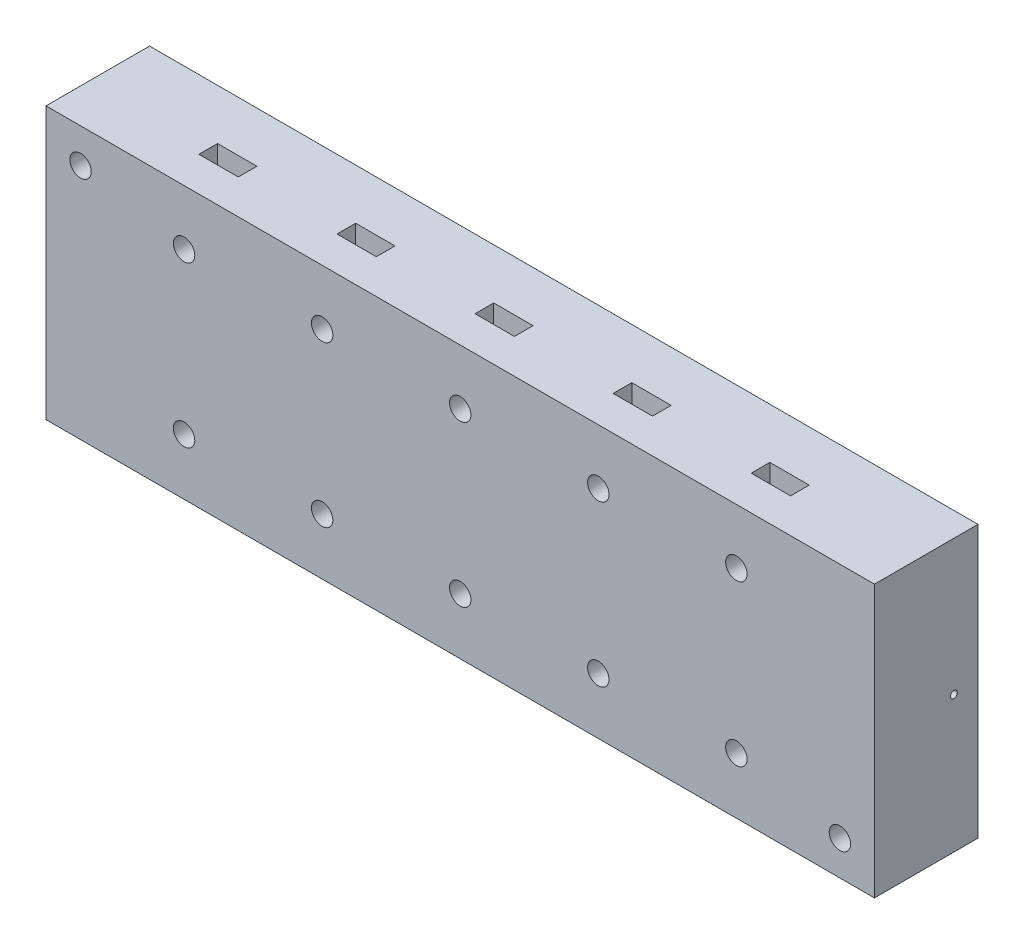
from build123d import *

# Parameters (mm, degrees)
SKIZZE2_W                        = 120
SKIZZE2_H                        = 39.364160046
AUFSATZ_LINEAR_AUSTRAGEN1_DEPTH  = 30
SKIZZE24_R                       = 1.55
SCHNITT_LINEAR_AUSTRAGEN4_DEPTH  = 130.805766806
SKIZZE46_R                       = 2.85
SCHNITT_LINEAR_AUSTRAGEN15_DEPTH = 10
SCHNITT_LINEAR_START             = -5
SCHNITT_LINEAR_AUSTRAGEN25_DEPTH = 2.7
LINEARES_MUSTER1_COUNT           = 5
LINEARES_MUSTER1_PITCH           = 20
SPIEGELN2_COPY_1_SKETCH_R        = 2.85
SPIEGELN2_COPY_1_DEPTH           = 10
SPIEGELN2_COPY_2_SKETCH_R        = 2.85
SPIEGELN2_COPY_2_DEPTH           = 10
SPIEGELN2_COPY_3_SKETCH_R        = 2.85
SPIEGELN2_COPY_3_DEPTH           = 10
SPIEGELN2_COPY_4_SKETCH_R        = 2.85
SPIEGELN2_COPY_4_DEPTH           = 10
SPIEGELN2_START                  = -5
SPIEGELN2_COPY_5_DEPTH           = 2.7
SPIEGELN2_COPY_6_DEPTH           = 2.7
SPIEGELN2_COPY_7_DEPTH           = 2.7
SPIEGELN2_COPY_8_DEPTH           = 2.7
SKIZZE51_R                       = 1.55
SCHNITT_LINEAR_AUSTRAGEN26_DEPTH = 130.805766806
SKIZZE67_R                       = 0.5
SCHNITT_LINEAR_AUSTRAGEN28_DEPTH = 16
SKIZZE68_R                       = 0.65
SCHNITT_LINEAR_AUSTRAGEN30_DEPTH = 16
SKIZZE70_R                       = 2
SCHNITT_LINEAR_AUSTRAGEN31_DEPTH = 6
ABSPALTEN3_OUTLINE_W             = 120
ABSPALTEN3_OUTLINE_H             = 39.364160046
ABSPALTEN3_OUTLINE_R             = 1.55
ABSPALTEN3_DEPTH                 = 15


# Read off the part's stored shape, not the designer's step: Abspalten3
with BuildPart() as part:
    # Skizze2 → Aufsatz-Linear austragen1 (new body)
    with BuildSketch(Plane.XY):
        with Locations((60, 19.682080023)):
            Rectangle(SKIZZE2_W, SKIZZE2_H)
    extrude(amount=AUFSATZ_LINEAR_AUSTRAGEN1_DEPTH)

    # Skizze24 → Schnitt-Linear austragen4 (cut, through all)
    with BuildSketch(Plane.XY.offset(30)):
        with Locations((20, 31.364160046)):
            Circle(SKIZZE24_R)
        with Locations((40, 31.364160046)):
            Circle(SKIZZE24_R)
        with Locations((60, 31.364160046)):
            Circle(SKIZZE24_R)
        with Locations((80, 31.364160046)):
            Circle(SKIZZE24_R)
        with Locations((100, 31.364160046)):
            Circle(SKIZZE24_R)
    schnitt_linear_austragen4 = extrude(amount=-SCHNITT_LINEAR_AUSTRAGEN4_DEPTH, mode=Mode.SUBTRACT)

    # Skizze46 → Schnitt-Linear austragen15 (cut)
    with BuildSketch(Plane(origin=(0, 0, 0), x_dir=(-1, 0, 0), z_dir=(0, 0, -1))):
        with Locations((-100, 31.364160046)):
            Circle(SKIZZE46_R)
    schnitt_linear_austragen15 = extrude(amount=-SCHNITT_LINEAR_AUSTRAGEN15_DEPTH, mode=Mode.SUBTRACT)

    # Skizze50 → Schnitt-Linear austragen25 (cut)
    with BuildSketch(Plane.XY.offset(30).offset(SCHNITT_LINEAR_START)):
        Polygon((97.15, 33.009608314), (97.15, 39.364160046), (102.85, 39.364160046), (102.85, 33.009608314), (102.85, 29.718711779), (100, 28.073263512), (97.15, 29.718711779), align=None)
    schnitt_linear_austragen25 = extrude(amount=-SCHNITT_LINEAR_AUSTRAGEN25_DEPTH, mode=Mode.SUBTRACT)

    # Lineares Muster1: Schnitt-Linear austragen15, Schnitt-Linear austragen25 ×5
    with Locations(*[(-i * LINEARES_MUSTER1_PITCH, 0, 0) for i in range(1, LINEARES_MUSTER1_COUNT)]):
        add(schnitt_linear_austragen15, mode=Mode.SUBTRACT)
        add(schnitt_linear_austragen25, mode=Mode.SUBTRACT)

    # Spiegeln2: Schnitt-Linear austragen15, Schnitt-Linear austragen25 across plane
    add(schnitt_linear_austragen15.mirror(Plane.ZX.offset(19.764160046)), mode=Mode.SUBTRACT)
    add(schnitt_linear_austragen25.mirror(Plane.ZX.offset(19.764160046)), mode=Mode.SUBTRACT)

    # Spiegeln2 copy 1 sketch → Spiegeln2 copy 1 (cut)
    with BuildSketch(Plane(origin=(-20, 39.528320093, 0), x_dir=(-1, 0, 0), z_dir=(0, 0, -1))):
        with Locations((-100, -31.364160046)):
            Circle(SPIEGELN2_COPY_1_SKETCH_R)
    extrude(amount=-SPIEGELN2_COPY_1_DEPTH, mode=Mode.SUBTRACT)

    # Spiegeln2 copy 2 sketch → Spiegeln2 copy 2 (cut)
    with BuildSketch(Plane(origin=(-40, 39.528320093, 0), x_dir=(-1, 0, 0), z_dir=(0, 0, -1))):
        with Locations((-100, -31.364160046)):
            Circle(SPIEGELN2_COPY_2_SKETCH_R)
    extrude(amount=-SPIEGELN2_COPY_2_DEPTH, mode=Mode.SUBTRACT)

    # Spiegeln2 copy 3 sketch → Spiegeln2 copy 3 (cut)
    with BuildSketch(Plane(origin=(-60, 39.528320093, 0), x_dir=(-1, 0, 0), z_dir=(0, 0, -1))):
        with Locations((-100, -31.364160046)):
            Circle(SPIEGELN2_COPY_3_SKETCH_R)
    extrude(amount=-SPIEGELN2_COPY_3_DEPTH, mode=Mode.SUBTRACT)

    # Spiegeln2 copy 4 sketch → Spiegeln2 copy 4 (cut)
    with BuildSketch(Plane(origin=(-80, 39.528320093, 0), x_dir=(-1, 0, 0), z_dir=(0, 0, -1))):
        with Locations((-100, -31.364160046)):
            Circle(SPIEGELN2_COPY_4_SKETCH_R)
    extrude(amount=-SPIEGELN2_COPY_4_DEPTH, mode=Mode.SUBTRACT)

    # Spiegeln2 copy 5 sketch → Spiegeln2 copy 5 (cut)
    with BuildSketch(Plane(origin=(-20, 39.528320093, 30), x_dir=(1, 0, 0), z_dir=(0, 0, 1)).offset(SPIEGELN2_START)):
        Polygon((97.15, -33.009608314), (97.15, -39.364160046), (102.85, -39.364160046), (102.85, -33.009608314), (102.85, -29.718711779), (100, -28.073263512), (97.15, -29.718711779), align=None)
    extrude(amount=-SPIEGELN2_COPY_5_DEPTH, mode=Mode.SUBTRACT)

    # Spiegeln2 copy 6 sketch → Spiegeln2 copy 6 (cut)
    with BuildSketch(Plane(origin=(-40, 39.528320093, 30), x_dir=(1, 0, 0), z_dir=(0, 0, 1)).offset(SPIEGELN2_START)):
        Polygon((97.15, -33.009608314), (97.15, -39.364160046), (102.85, -39.364160046), (102.85, -33.009608314), (102.85, -29.718711779), (100, -28.073263512), (97.15, -29.718711779), align=None)
    extrude(amount=-SPIEGELN2_COPY_6_DEPTH, mode=Mode.SUBTRACT)

    # Spiegeln2 copy 7 sketch → Spiegeln2 copy 7 (cut)
    with BuildSketch(Plane(origin=(-60, 39.528320093, 30), x_dir=(1, 0, 0), z_dir=(0, 0, 1)).offset(SPIEGELN2_START)):
        Polygon((97.15, -33.009608314), (97.15, -39.364160046), (102.85, -39.364160046), (102.85, -33.009608314), (102.85, -29.718711779), (100, -28.073263512), (97.15, -29.718711779), align=None)
    extrude(amount=-SPIEGELN2_COPY_7_DEPTH, mode=Mode.SUBTRACT)

    # Spiegeln2 copy 8 sketch → Spiegeln2 copy 8 (cut)
    with BuildSketch(Plane(origin=(-80, 39.528320093, 30), x_dir=(1, 0, 0), z_dir=(0, 0, 1)).offset(SPIEGELN2_START)):
        Polygon((97.15, -33.009608314), (97.15, -39.364160046), (102.85, -39.364160046), (102.85, -33.009608314), (102.85, -29.718711779), (100, -28.073263512), (97.15, -29.718711779), align=None)
    extrude(amount=-SPIEGELN2_COPY_8_DEPTH, mode=Mode.SUBTRACT)

    # Spiegeln3: Schnitt-Linear austragen4 across plane
    add(schnitt_linear_austragen4.mirror(Plane.ZX.offset(19.764160046)), mode=Mode.SUBTRACT)

    # Skizze51 → Schnitt-Linear austragen26 (cut, through all)
    with BuildSketch(Plane.XY.offset(30)):
        with Locations((5, 34.364160046)):
            Circle(SKIZZE51_R)
        with Locations((115, 5)):
            Circle(SKIZZE51_R)
    extrude(amount=-SCHNITT_LINEAR_AUSTRAGEN26_DEPTH, mode=Mode.SUBTRACT)

    # Skizze66 → Schnitt-Rotation5 (revolve, cut)
    with BuildSketch(Plane.XY.offset(15), mode=Mode.PRIVATE) as schnitt_rotation5_sk:
        Polygon((110, 19.682080023), (110, 21.182080023), (10, 22.682080023), (10, 19.682080023), align=None)
        Polygon((105, 19.682080023), (105, 23.757361257), (15, 25.107361257), (15, 19.682080023), align=None)
    revolve(schnitt_rotation5_sk.sketch.rotate(Axis((10, 19.682080023, 15), (1, 0, 0)), 180), axis=Axis((10, 19.682080023, 15), (1, 0, 0)), mode=Mode.SUBTRACT)

    # Skizze67 → Schnitt-Linear austragen28 (cut)
    with BuildSketch(Plane(origin=(120, 0, 0), x_dir=(0, 0, -1), z_dir=(1, 0, 0))):
        with Locations((-18.5, 19.764160046)):
            Circle(SKIZZE67_R)
    schnitt_linear_austragen28 = extrude(amount=-SCHNITT_LINEAR_AUSTRAGEN28_DEPTH, mode=Mode.SUBTRACT)

    # Spiegeln5: Schnitt-Linear austragen28 across plane
    add(schnitt_linear_austragen28.mirror(Plane.XY.offset(15)), mode=Mode.SUBTRACT)

    # Skizze68 → Schnitt-Linear austragen30 (cut)
    with BuildSketch(Plane.ZY):
        with Locations((10.25, 19.764160046)):
            Circle(SKIZZE68_R)
    extrude(amount=-SCHNITT_LINEAR_AUSTRAGEN30_DEPTH, mode=Mode.SUBTRACT)

    # Skizze70 → Schnitt-Linear austragen31 (cut)
    with BuildSketch(Plane.ZY):
        with Locations((10.25, 19.764160046)):
            Circle(SKIZZE70_R)
    extrude(amount=-SCHNITT_LINEAR_AUSTRAGEN31_DEPTH, mode=Mode.SUBTRACT)

    # Abspalten3 outline → Abspalten3 (cut)
    with BuildSketch(Plane.XY):
        with Locations((60, 19.682080023)):
            Rectangle(ABSPALTEN3_OUTLINE_W, ABSPALTEN3_OUTLINE_H)
        with Locations((115, 5)):
            Circle(ABSPALTEN3_OUTLINE_R, mode=Mode.SUBTRACT)
        with Locations((5, 34.364160046)):
            Circle(ABSPALTEN3_OUTLINE_R, mode=Mode.SUBTRACT)
        with Locations((20, 8.164160046)):
            Circle(ABSPALTEN3_OUTLINE_R, mode=Mode.SUBTRACT)
        with Locations((40, 8.164160046)):
            Circle(ABSPALTEN3_OUTLINE_R, mode=Mode.SUBTRACT)
        with Locations((60, 8.164160046)):
            Circle(ABSPALTEN3_OUTLINE_R, mode=Mode.SUBTRACT)
        with Locations((80, 8.164160046)):
            Circle(ABSPALTEN3_OUTLINE_R, mode=Mode.SUBTRACT)
        with Locations((100, 8.164160046)):
            Circle(ABSPALTEN3_OUTLINE_R, mode=Mode.SUBTRACT)
        with Locations((20, 31.364160046)):
            Circle(ABSPALTEN3_OUTLINE_R, mode=Mode.SUBTRACT)
        with Locations((40, 31.364160046)):
            Circle(ABSPALTEN3_OUTLINE_R, mode=Mode.SUBTRACT)
        with Locations((60, 31.364160046)):
            Circle(ABSPALTEN3_OUTLINE_R, mode=Mode.SUBTRACT)
        with Locations((80, 31.364160046)):
            Circle(ABSPALTEN3_OUTLINE_R, mode=Mode.SUBTRACT)
        with Locations((100, 31.364160046)):
            Circle(ABSPALTEN3_OUTLINE_R, mode=Mode.SUBTRACT)
    extrude(amount=ABSPALTEN3_DEPTH, mode=Mode.SUBTRACT)


solid = part.part
